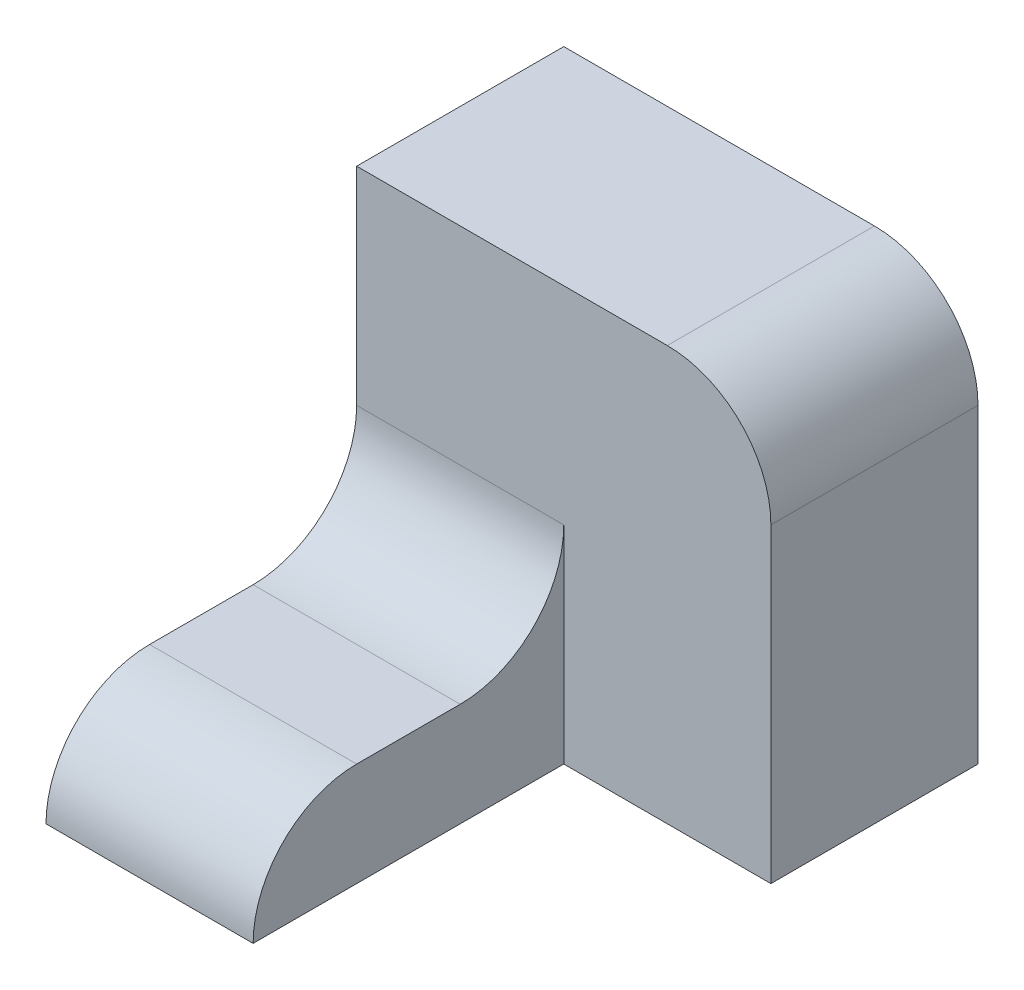
from build123d import *

# Parameters (mm, degrees)
SKETCH1_W           = 20
SKETCH1_H           = 10
BOSS_EXTRUDE1_DEPTH = 30
SKETCH2_W           = 40
SKETCH2_H           = 40
BOSS_EXTRUDE2_DEPTH = 20
FILLET1_R           = 10


with BuildPart() as part:
    # Sketch1 → Boss-Extrude1 (new body)
    with BuildSketch(Plane.XY):
        with Locations((-20, -5)):
            Rectangle(SKETCH1_W, SKETCH1_H)
    extrude(amount=BOSS_EXTRUDE1_DEPTH)

    # Sketch2 → Boss-Extrude2 (add)
    with BuildSketch(Plane.XY):
        with Locations((-10, 10)):
            Rectangle(SKETCH2_W, SKETCH2_H)
    extrude(amount=-BOSS_EXTRUDE2_DEPTH)

    # Fillet1
    fillet1_edges = [part.edges().sort_by_distance(p)[0] for p in [
        (-20, 0, 0),
        (10, 30, -10),
        (-20, 0, 30),
    ]]
    fillet(fillet1_edges, radius=FILLET1_R - 0.0001)  # a hair under: the kernel refuses the full size


solid = part.part
